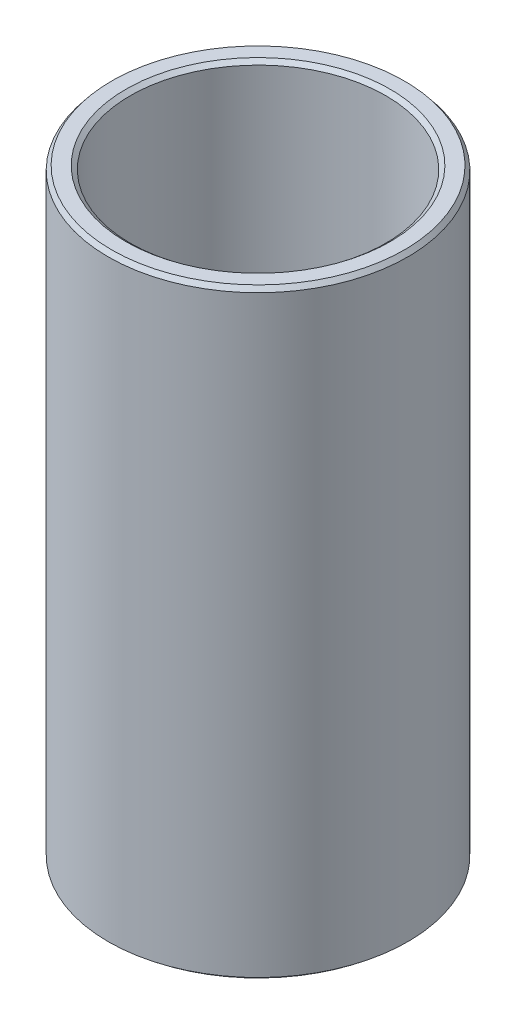
from build123d import *
from OCP.BRepFilletAPI import BRepFilletAPI_MakeChamfer

# Parameters (mm, degrees)
SKETCH1_R           = 27.5
BOSS_EXTRUDE1_DEPTH = 110.297400038
SKETCH2_R           = 23.459976172
CUT_EXTRUDE1_DEPTH  = 117.953052355
CHAMFER1_SIZE       = 0.795353642
CHAMFER1_SIZE2      = 0.636816709


with BuildPart() as part:
    # Sketch1 → Boss-Extrude1 (new body)
    with BuildSketch(Plane(origin=(0, 0, 0), x_dir=(1, 0, 0), z_dir=(0, 1, 0))):
        Circle(SKETCH1_R)
    extrude(amount=BOSS_EXTRUDE1_DEPTH)

    # Sketch2 → Cut-Extrude1 (cut, through all)
    with BuildSketch(Plane(origin=(0, 0, 0), x_dir=(1, 0, 0), z_dir=(0, 1, 0))):
        Circle(SKETCH2_R)
    extrude(amount=CUT_EXTRUDE1_DEPTH, mode=Mode.SUBTRACT)

    # Chamfer1: one chamfer whose edges measure the first distance from different faces: ONE call of the kernel's chamfer builder (chamfer() names one face for all edges)
    chamfer1_edges_1 = [part.edges().sort_by_distance(p)[0] for p in [
        (-23.459976172, 110.297400038, 0),
    ]]
    chamfer1_side_1 = [part.faces().sort_by_distance(p)[0] for p in [
        (-26.722182541, 110.297400038, 0),
    ]]
    chamfer1_edges_2 = [part.edges().sort_by_distance(p)[0] for p in [
        (-23.459976172, 0, 0),
    ]]
    chamfer1_side_2 = [part.faces().sort_by_distance(p)[0] for p in [
        (-23.459976172, 55.148700019, 0),
    ]]
    chamfer1_edges_3 = [part.edges().sort_by_distance(p)[0] for p in [
        (-27.5, 0, 0),
    ]]
    chamfer1_side_3 = [part.faces().sort_by_distance(p)[0] for p in [
        (-26.722182541, 0, 0),
    ]]
    chamfer1_edges_4 = [part.edges().sort_by_distance(p)[0] for p in [
        (-27.5, 110.297400038, 0),
    ]]
    chamfer1_side_4 = [part.faces().sort_by_distance(p)[0] for p in [
        (-27.5, 55.148700019, 0),
    ]]
    chamfer1 = BRepFilletAPI_MakeChamfer(part.part.solid().wrapped)
    for e in chamfer1_edges_1:
        chamfer1.Add(CHAMFER1_SIZE, CHAMFER1_SIZE2, e.wrapped, chamfer1_side_1[0].wrapped)  # the first distance lies on this face
    for e in chamfer1_edges_2:
        chamfer1.Add(CHAMFER1_SIZE, CHAMFER1_SIZE2, e.wrapped, chamfer1_side_2[0].wrapped)  # the first distance lies on this face
    for e in chamfer1_edges_3:
        chamfer1.Add(CHAMFER1_SIZE, CHAMFER1_SIZE2, e.wrapped, chamfer1_side_3[0].wrapped)  # the first distance lies on this face
    for e in chamfer1_edges_4:
        chamfer1.Add(CHAMFER1_SIZE, CHAMFER1_SIZE2, e.wrapped, chamfer1_side_4[0].wrapped)  # the first distance lies on this face
    add(Compound.cast(chamfer1.Shape()), mode=Mode.REPLACE)


solid = part.part
